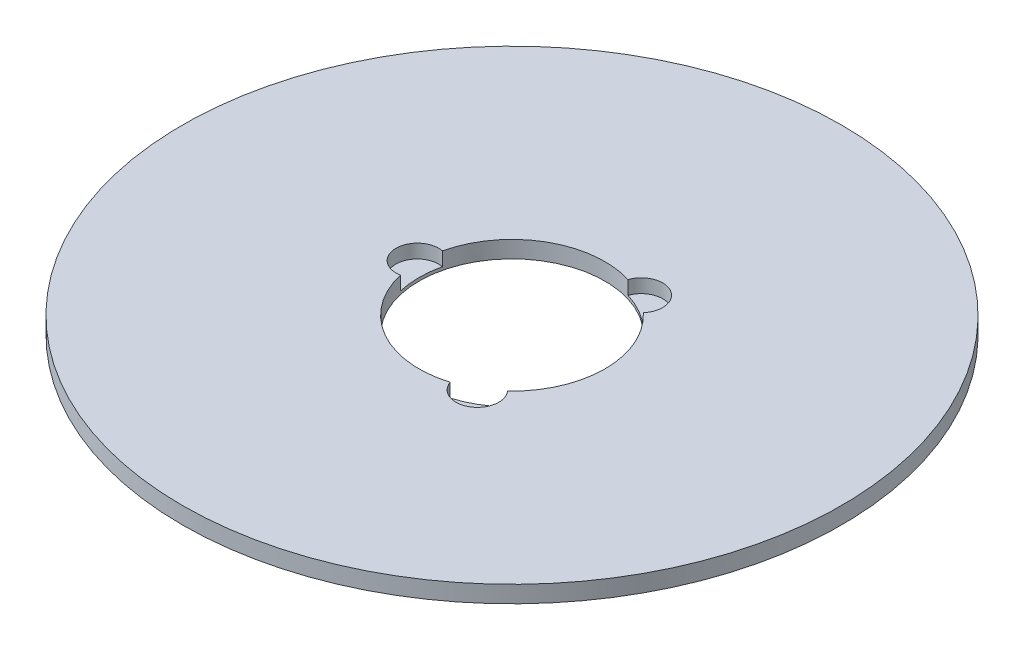
from build123d import *

# Parameters (mm, degrees)
SKETCH1_R           = 97.5
BOSS_EXTRUDE1_DEPTH = 5
SKETCH2_R           = 27.5
CUT_EXTRUDE1_DEPTH  = 138.976447265
SKETCH3_R           = 6.325847544
CUT_EXTRUDE2_DEPTH  = 4.064145518
CIRPATTERN1_COUNT   = 3


with BuildPart() as part:
    # Sketch1 → Boss-Extrude1 (new body)
    with BuildSketch(Plane(origin=(0, 0, 0), x_dir=(1, 0, 0), z_dir=(0, 1, 0))):
        Circle(SKETCH1_R)
    extrude(amount=BOSS_EXTRUDE1_DEPTH)

    # Sketch2 → Cut-Extrude1 (cut, through all)
    with BuildSketch(Plane(origin=(0, 0, 0), x_dir=(1, 0, 0), z_dir=(0, 1, 0))):
        Circle(SKETCH2_R)
    extrude(amount=CUT_EXTRUDE1_DEPTH, mode=Mode.SUBTRACT)

    # Sketch3 → Cut-Extrude2 (cut)
    with BuildSketch(Plane(origin=(0, 5, 0), x_dir=(1, 0, 0), z_dir=(0, 1, 0))):
        with Locations((-28.013239074, 0)):
            Circle(SKETCH3_R)
    cut_extrude2 = extrude(amount=-CUT_EXTRUDE2_DEPTH, mode=Mode.SUBTRACT)

    # CirPattern1: Cut-Extrude2 ×3 about axis
    cirpattern1_axis = Axis((0, 0, 0), (0, 1, 0))
    for i in range(1, CIRPATTERN1_COUNT):
        add(cut_extrude2.rotate(cirpattern1_axis, i * 360 / CIRPATTERN1_COUNT), mode=Mode.SUBTRACT)


solid = part.part
